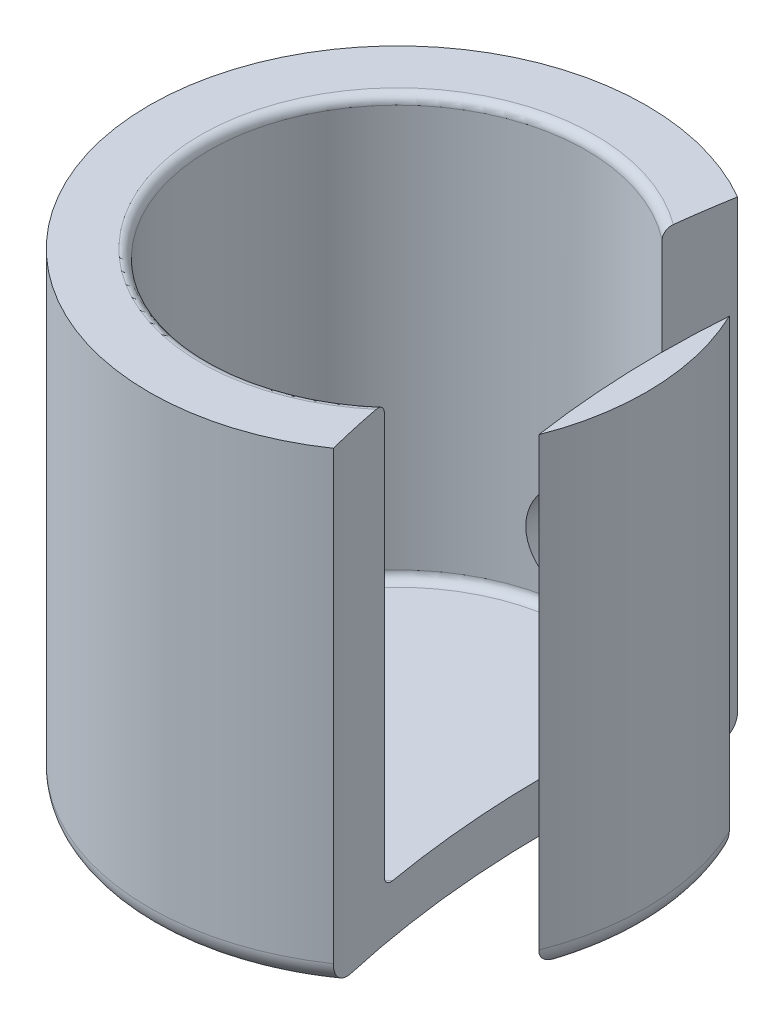
from build123d import *

# Parameters (mm, degrees)
FILLET1_R          = 1.3
SKETCH3_R          = 3
CUT_EXTRUDE1_DEPTH = 20
FILLET3_R          = 0.5
FILLET4_R          = 0.5
CAVITY1_DEPTH      = 26.65


# Read off the part's stored shape, not the designer's step: Cavity1
with BuildPart() as part:
    # Sketch2 → Revolve1 (revolve)
    with BuildSketch(Plane(origin=(0, 0, 0), x_dir=(0, 0, -1), z_dir=(1, 0, 0)), mode=Mode.PRIVATE) as revolve1_sk:
        Polygon((0, 0), (14.115, 0), (14.115, 26.65), (10.7, 26.65), (10.7, 2.79), (0, 2.79), align=None)
    revolve(revolve1_sk.sketch.rotate(Axis((0, 29.213224894, 0), (0, -1, 0)), 180), axis=Axis((0, 29.213224894, 0), (0, -1, 0)))

    # Fillet1
    fillet1_edges = [part.edges().sort_by_distance(p)[0] for p in [
        (0, 0, -14.115),
    ]]
    fillet(fillet1_edges, radius=FILLET1_R)

    # Sketch3 → Cut-Extrude1 (cut)
    with BuildSketch(Plane.XY):
        with Locations((0, 6.37)):
            Circle(SKETCH3_R)
    extrude(amount=-CUT_EXTRUDE1_DEPTH, mode=Mode.SUBTRACT)

    # Fillet3
    fillet3_edges = [part.edges().sort_by_distance(p)[0] for p in [
        (0, 2.79, -10.7),
    ]]
    fillet(fillet3_edges, radius=FILLET3_R)

    # Fillet4
    fillet4_edges = [part.edges().sort_by_distance(p)[0] for p in [
        (0, 26.65, -10.7),
    ]]
    fillet(fillet4_edges, radius=FILLET4_R)

    # Cavity1 outline → Cavity1 (cut)
    with BuildSketch(Plane(origin=(0, 0, 0), x_dir=(1, 0, 0), z_dir=(0, 1, 0))):
        with BuildLine():
            ThreePointArc((7.981344541, -11.641793862), (11.053202959, -8.778378515), (13.146668661, -5.137930335))
            ThreePointArc((13.146668661, -5.137930335), (12.626305345, 0.468655883), (12.729603647, 6.098398951))
            ThreePointArc((12.729603647, 6.098398951), (10.37200886, 9.573643883), (7.096314041, 12.201456963))
            ThreePointArc((7.096314041, 12.201456963), (6.280674733, 0.233130633), (7.981344541, -11.641793862))
        make_face()
    extrude(amount=CAVITY1_DEPTH, mode=Mode.SUBTRACT)


solid = part.part
